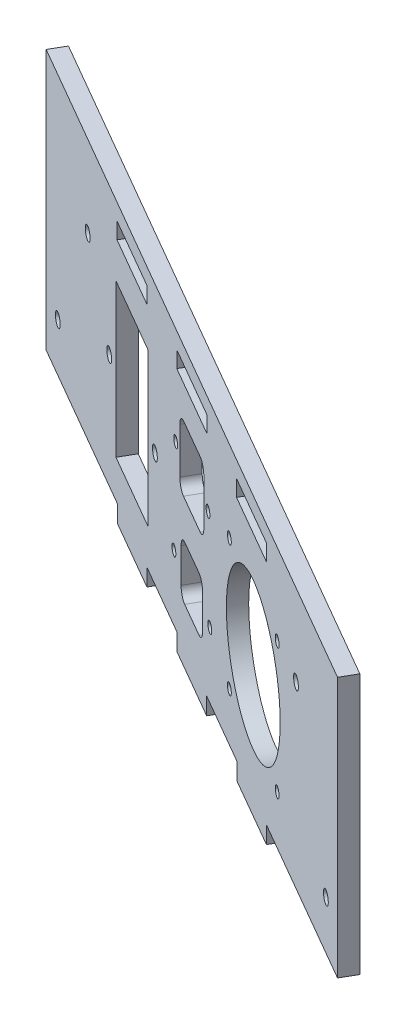
from build123d import *

# Parameters (mm, degrees)
STOCK_ACRYLIC_BAY_WALL_MASTER_1_START     = 163.456714755
STOCK_ACRYLIC_BAY_WALL_MASTER_1_OUTLINE_R = 2
STOCK_ACRYLIC_BAY_WALL_MASTER_1_DEPTH     = 5
SKETCH1_W                                 = 243.769145362
SKETCH1_H                                 = 5
BOSS_EXTRUDE1_DEPTH                       = 5
SKETCH2_W                                 = 25.2
SKETCH2_H                                 = 5
CUT_EXTRUDE1_DEPTH                        = 158.991773268
SKETCH3_R                                 = 1.6
CUT_EXTRUDE2_DEPTH                        = 158.991773268
SKETCH4_R                                 = 2
SKETCH4_W                                 = 27
SKETCH4_H                                 = 46.8
CUT_EXTRUDE3_DEPTH                        = 158.991773268
SKETCH5_R                                 = 22.5
SKETCH5_R_2                               = 1.6
CUT_EXTRUDE4_DEPTH                        = 158.991773268


# Read off the part's stored shape, not the designer's step: Stock-acrylic-bay-wall-master-1
with BuildPart() as part:
    # Stock-acrylic-bay-wall-master-1 outline → Stock-acrylic-bay-wall-master-1 (new body)
    with BuildSketch(Plane(origin=(0, 0, 0), x_dir=(0.866025403784438, 0, 0.500000000000001), z_dir=(0.500000000000001, 0, -0.866025403784438)).offset(STOCK_ACRYLIC_BAY_WALL_MASTER_1_START)):
        Polygon((-121.884572681, 15), (121.884572681, 15), (121.884572681, 89.75), (62.4, 89.75), (62.4, 95), (37.6, 95), (37.6, 89.75), (12.4, 89.75), (12.4, 95), (-12.4, 95), (-12.4, 89.75), (-37.6, 89.75), (-37.6, 95), (-62.4, 95), (-62.4, 89.75), (-121.884572681, 89.75), align=None)
        with Locations((-87.134572681, 35)):
            Circle(STOCK_ACRYLIC_BAY_WALL_MASTER_1_OUTLINE_R, mode=Mode.SUBTRACT)
        with Locations((87.134572681, 35)):
            Circle(STOCK_ACRYLIC_BAY_WALL_MASTER_1_OUTLINE_R, mode=Mode.SUBTRACT)
        with Locations((-112.134572681, 75)):
            Circle(STOCK_ACRYLIC_BAY_WALL_MASTER_1_OUTLINE_R, mode=Mode.SUBTRACT)
        with Locations((112.134572681, 75)):
            Circle(STOCK_ACRYLIC_BAY_WALL_MASTER_1_OUTLINE_R, mode=Mode.SUBTRACT)
    extrude(amount=STOCK_ACRYLIC_BAY_WALL_MASTER_1_DEPTH)

    # Sketch1 → Boss-Extrude1 (add)
    with BuildSketch(Plane(origin=(84.228357378, 0, -145.887794416), x_dir=(-0.8660254037844382, 0, -0.5000000000000009), z_dir=(0.5000000000000009, 0, -0.8660254037844382))):
        with Locations((0, -12.5)):
            Rectangle(SKETCH1_W, SKETCH1_H)
    extrude(amount=-BOSS_EXTRUDE1_DEPTH)

    # Sketch2 → Cut-Extrude1 (cut, through all)
    with BuildSketch(Plane(origin=(84.228357378, 0, -145.887794416), x_dir=(-0.8660254037844382, 0, -0.5000000000000009), z_dir=(0.5000000000000009, 0, -0.8660254037844382))):
        with Locations((-50, -17.5)):
            Rectangle(SKETCH2_W, SKETCH2_H)
        with Locations((0, -17.5)):
            Rectangle(SKETCH2_W, SKETCH2_H)
        with Locations((50, -17.5)):
            Rectangle(SKETCH2_W, SKETCH2_H)
    extrude(amount=-CUT_EXTRUDE1_DEPTH, mode=Mode.SUBTRACT)

    # Sketch3 → Cut-Extrude2 (cut, through all)
    with BuildSketch(Plane(origin=(84.228357378, 0, -145.887794416), x_dir=(-0.8660254037844382, 0, -0.5000000000000009), z_dir=(0.5000000000000009, 0, -0.8660254037844382))):
        with Locations((13.5, -40)):
            Circle(SKETCH3_R)
        with Locations((-13.5, -40)):
            Circle(SKETCH3_R)
        with Locations((15, -69.75)):
            Circle(SKETCH3_R)
        with Locations((-15, -69.75)):
            Circle(SKETCH3_R)
        with BuildLine():
            Line((10, -47), (10, -33))
            ThreePointArc((10, -33), (9.121320344, -30.878679656), (7, -30))
            Line((7, -30), (-7, -30))
            ThreePointArc((-7, -30), (-9.121320344, -30.878679656), (-10, -33))
            Line((-10, -33), (-10, -47))
            ThreePointArc((-10, -47), (-9.121320344, -49.121320344), (-7, -50))
            Line((-7, -50), (7, -50))
            ThreePointArc((7, -50), (9.121320344, -49.121320344), (10, -47))
        make_face()
        with BuildLine():
            Line((-6, -61.5), (6, -61.5))
            ThreePointArc((6, -61.5), (8.121320344, -62.378679656), (9, -64.5))
            Line((9, -64.5), (9, -75))
            ThreePointArc((9, -75), (8.121320344, -77.121320344), (6, -78))
            Line((6, -78), (-6, -78))
            ThreePointArc((-6, -78), (-8.121320344, -77.121320344), (-9, -75))
            Line((-9, -75), (-9, -64.5))
            ThreePointArc((-9, -64.5), (-8.121320344, -62.378679656), (-6, -61.5))
        make_face()
    extrude(amount=-CUT_EXTRUDE2_DEPTH, mode=Mode.SUBTRACT)

    # Sketch4 → Cut-Extrude3 (cut, through all)
    with BuildSketch(Plane(origin=(84.228357378, 0, -145.887794416), x_dir=(-0.8660254037844382, 0, -0.5000000000000009), z_dir=(0.5000000000000009, 0, -0.8660254037844382))):
        with Locations((69.1, -54.875)):
            Circle(SKETCH4_R)
        with Locations((30.9, -54.875)):
            Circle(SKETCH4_R)
        with Locations((50, -54.875)):
            Rectangle(SKETCH4_W, SKETCH4_H)
    extrude(amount=-CUT_EXTRUDE3_DEPTH, mode=Mode.SUBTRACT)

    # Sketch5 → Cut-Extrude4 (cut, through all)
    with BuildSketch(Plane(origin=(84.228357378, 0, -145.887794416), x_dir=(-0.8660254037844382, 0, -0.5000000000000009), z_dir=(0.5000000000000009, 0, -0.8660254037844382))):
        with Locations((-51.4, -54.875)):
            Circle(SKETCH5_R)
        with Locations((-71.4, -34.875)):
            Circle(SKETCH5_R_2)
        with Locations((-31.4, -34.875)):
            Circle(SKETCH5_R_2)
        with Locations((-31.4, -74.875)):
            Circle(SKETCH5_R_2)
        with Locations((-71.4, -74.875)):
            Circle(SKETCH5_R_2)
    extrude(amount=-CUT_EXTRUDE4_DEPTH, mode=Mode.SUBTRACT)


solid = part.part
